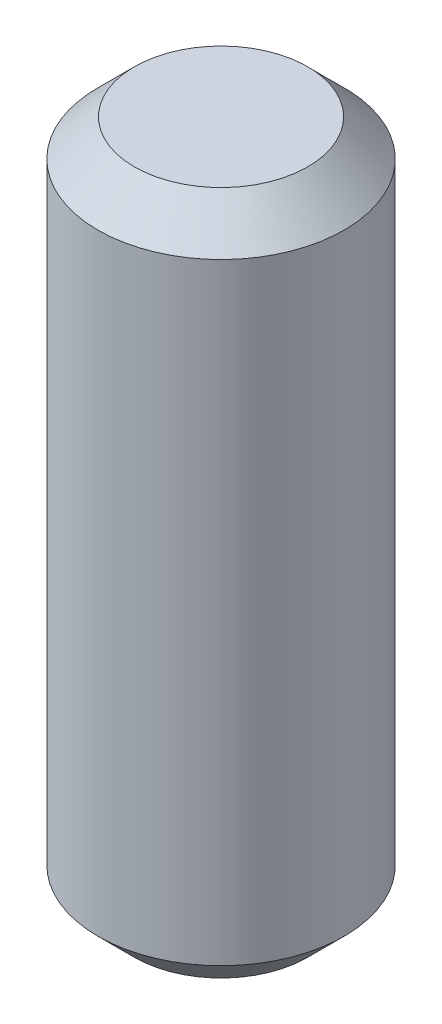
from build123d import *

# Parameters (mm, degrees)
SKETCH1_R           = 2.7
BOSS_EXTRUDE1_DEPTH = 15
CHAMFER1_SIZE       = 0.8


with BuildPart() as part:
    # Sketch1 → Boss-Extrude1 (new body)
    with BuildSketch(Plane(origin=(0, 0, 0), x_dir=(1, 0, 0), z_dir=(0, 1, 0))):
        Circle(SKETCH1_R)
    extrude(amount=BOSS_EXTRUDE1_DEPTH)

    # Chamfer1
    chamfer1_edges = [part.edges().sort_by_distance(p)[0] for p in [
        (-2.7, 0, 0),
        (-2.7, 15, 0),
    ]]
    chamfer(chamfer1_edges, length=CHAMFER1_SIZE)


solid = part.part
